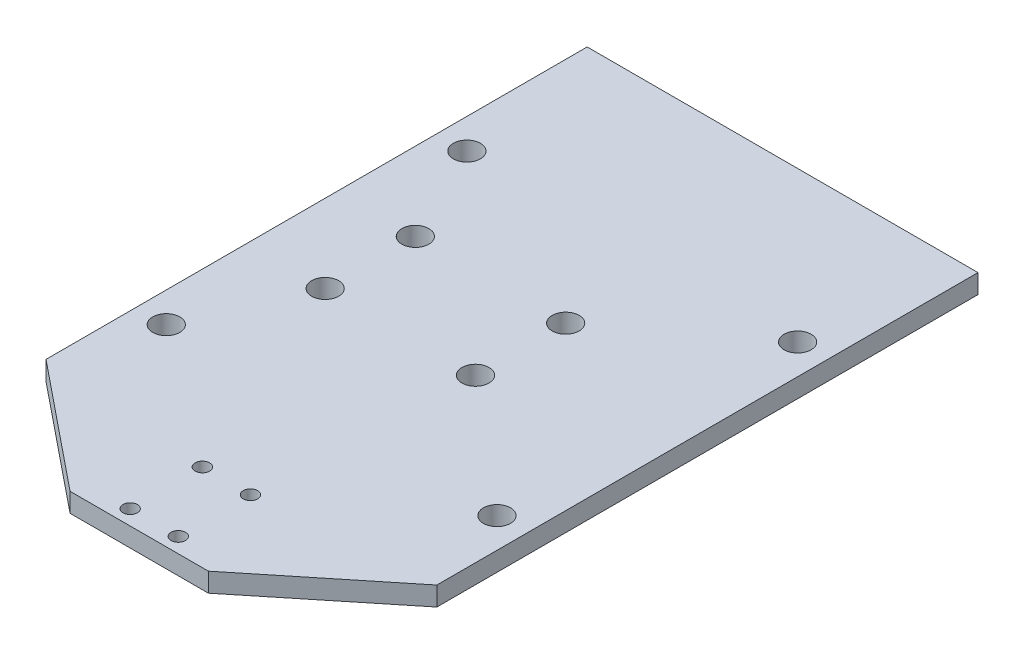
from build123d import *

# Parameters (mm, degrees)
BOSS_EXTRUDE1_DEPTH  = 1.5875
M2_CLEARANCE_HOLE1_D = 2.4
M4_CLEARANCE_HOLE1_D = 4.5
M4_CLEARANCE_HOLE2_D = 4.5


with BuildPart() as part:
    # Sketch1 → Boss-Extrude1 (new, symmetric)
    with BuildSketch(Plane(origin=(0, 0, 0), x_dir=(1, 0, 0), z_dir=(0, 1, 0))):
        Polygon((-32.5, -45), (-11.5, -62), (11.5, -62), (32.5, -45), (32.5, 45), (-32.5, 45), align=None)
    extrude(amount=BOSS_EXTRUDE1_DEPTH, both=True)

    # M2 Clearance Hole1 (through all)
    with Locations(Plane(origin=(0, 1.5875, 0), x_dir=(1, 0, 0), z_dir=(0, 1, 0))):
        with Locations((-4, -59.5), (4, -59.5), (4, -47.5), (-4, -47.5)):
            Hole(M2_CLEARANCE_HOLE1_D / 2)

    # M4 Clearance Hole1 (through all)
    with Locations(Plane(origin=(0, 1.5875, 0), x_dir=(1, 0, 0), z_dir=(0, 1, 0))):
        with Locations((-27.5, 20), (27.5, 20), (27.5, -30), (-27.5, -30)):
            Hole(M4_CLEARANCE_HOLE1_D / 2)

    # M4 Clearance Hole2 (through all)
    with Locations(Plane(origin=(0, 1.5875, 0), x_dir=(1, 0, 0), z_dir=(0, 1, 0))):
        with Locations((-19.5, -11.575), (-19.5, 3.425), (5.5, 3.425), (5.5, -11.575)):
            Hole(M4_CLEARANCE_HOLE2_D / 2)


solid = part.part
